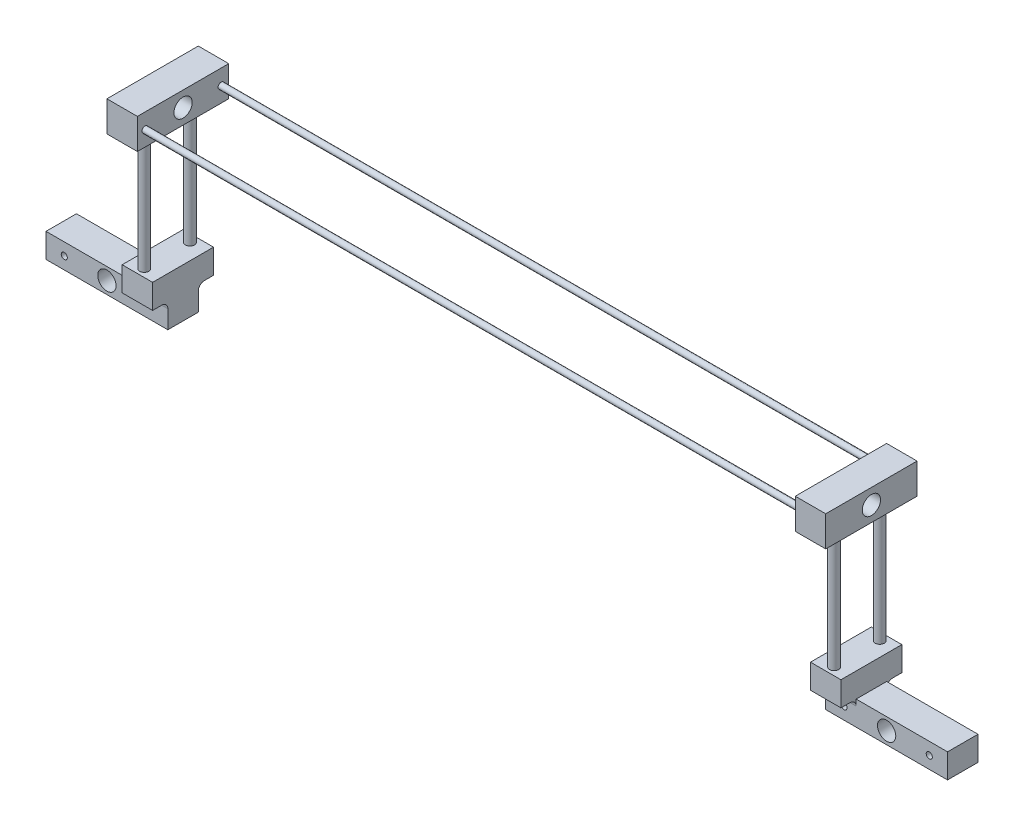
from build123d import *

# Parameters (mm, degrees)
SKETCH1_W                = 200
SKETCH1_H                = 40
SKETCH1_R                = 5
SKETCH1_R_2              = 15
BOSS_EXTRUDE2_DEPTH      = 50
BOSS_EXTRUDE2_2_DEPTH    = 50
SKETCH2_R                = 7.5
BOSS_EXTRUDE4_DEPTH      = 40
BOSS_EXTRUDE5_DEPTH      = 250
BOSS_EXTRUDE5_DEPTH_BACK = 40
SKETCH3_R                = 7.5
SKETCH4_W                = 50
SKETCH4_H                = 100
BOSS_EXTRUDE6_DEPTH      = 50
SKETCH5_R                = 15
CUT_EXTRUDE1_DEPTH       = 1180
SKETCH6_W                = 50
SKETCH6_H                = 25
BOSS_EXTRUDE8_DEPTH      = 50
SKETCH7_R                = 5
BOSS_EXTRUDE9_DEPTH      = 1180
FILLET1_R                = 10


with BuildPart() as part:
    # Sketch1 → Boss-Extrude2 (new body)
    with BuildSketch(Plane.XY):
        with Locations((-640, -58.42888126)):
            Rectangle(SKETCH1_W, SKETCH1_H)
        with Locations((-710, -58.42888126)):
            Circle(SKETCH1_R, mode=Mode.SUBTRACT)
        with Locations((-570, -58.42888126)):
            Circle(SKETCH1_R, mode=Mode.SUBTRACT)
        with Locations((-640, -58.42888126)):
            Circle(SKETCH1_R_2, mode=Mode.SUBTRACT)
    extrude(amount=BOSS_EXTRUDE2_DEPTH)



with BuildPart() as body_2:
    # Sketch1 → Boss-Extrude2 2 (new body)
    with BuildSketch(Plane.XY):
        Polygon((580, -38.42888126), (540, -38.42888126), (540, -78.42888126), (740, -78.42888126), (740, -38.42888126), align=None)
        with Locations((570, -58.42888126)):
            Circle(SKETCH1_R, mode=Mode.SUBTRACT)
        with Locations((640, -58.42888126)):
            Circle(SKETCH1_R_2, mode=Mode.SUBTRACT)
        with Locations((710, -58.42888126)):
            Circle(SKETCH1_R, mode=Mode.SUBTRACT)
    extrude(amount=BOSS_EXTRUDE2_2_DEPTH)


with BuildPart() as part_1:
    add(part.part)

    add(body_2.part)  # Boss-Extrude4 merges body 2
    # Sketch2 → Boss-Extrude4 (add)
    # profile 1 of 2: a face of its own
    with BuildSketch(Plane(origin=(0, -38.42888126, 0), x_dir=(1, 0, 0), z_dir=(0, 1, 0))):
        Polygon((540, -25), (540, -75), (590, -75), (590, -25), (590, 25), (540, 25), align=None)
        with Locations(Location((566.239219394, 12.5, 0), (0, 0, 180))):
            Circle(SKETCH2_R, mode=Mode.SUBTRACT)
        with Locations(Location((566.239219394, -62.5, 0), (0, 0, 180))):
            Circle(SKETCH2_R, mode=Mode.SUBTRACT)
    # profile 2 of 2: a face of its own
    with BuildSketch(Plane(origin=(0, -38.42888126, 0), x_dir=(1, 0, 0), z_dir=(0, 1, 0))):
        Polygon((-590, -25), (-590, 25), (-540, 25), (-540, -25), (-540, -75), (-590, -75), align=None)
        with Locations(Location((-566.239219394, -62.5, 0), (0, 0, 180))):
            Circle(SKETCH2_R, mode=Mode.SUBTRACT)
        with Locations(Location((-566.239219394, 12.5, 0), (0, 0, 180))):
            Circle(SKETCH2_R, mode=Mode.SUBTRACT)
    extrude(amount=BOSS_EXTRUDE4_DEPTH)

    # Sketch3 → Boss-Extrude5 (add, two sides: drawn at the far end of the back side and taken through both)
    with BuildSketch(Plane(origin=(0, 0, 0), x_dir=(1, 0, 0), z_dir=(0, 1, 0)).offset(-BOSS_EXTRUDE5_DEPTH_BACK)):
        with Locations(Location((-566.239219394, 12.5, 0), (0, 0, 270))):
            Circle(SKETCH3_R)
        with Locations(Location((-566.239219394, -62.5, 0), (0, 0, 270))):
            Circle(SKETCH3_R)
        with Locations(Location((566.239219394, 12.5, 0), (0, 0, 270))):
            Circle(SKETCH3_R)
        with Locations(Location((566.239219394, -62.5, 0), (0, 0, 270))):
            Circle(SKETCH3_R)
    extrude(amount=BOSS_EXTRUDE5_DEPTH + BOSS_EXTRUDE5_DEPTH_BACK)

    # Sketch4 → Boss-Extrude6 (add)
    with BuildSketch(Plane(origin=(0, 250, 0), x_dir=(1, 0, 0), z_dir=(0, 1, 0))):
        with Locations((565, -25)):
            Rectangle(SKETCH4_W, SKETCH4_H)
        with Locations((-565, -25)):
            Rectangle(SKETCH4_W, SKETCH4_H)
    extrude(amount=-BOSS_EXTRUDE6_DEPTH)

    # Sketch5 → Cut-Extrude1 (cut)
    with BuildSketch(Plane.ZY.offset(590)):
        with Locations((25, 225)):
            Circle(SKETCH5_R)
    extrude(amount=-CUT_EXTRUDE1_DEPTH, mode=Mode.SUBTRACT)

    # Sketch6 → Boss-Extrude8 (add)
    with BuildSketch(Plane(origin=(0, 250, 0), x_dir=(1, 0, 0), z_dir=(0, 1, 0))):
        with Locations((565, -87.5)):
            Rectangle(SKETCH6_W, SKETCH6_H)
        with Locations((565, 37.5)):
            Rectangle(SKETCH6_W, SKETCH6_H)
        with Locations((-565, -87.5)):
            Rectangle(SKETCH6_W, SKETCH6_H)
        with Locations((-565, 37.5)):
            Rectangle(SKETCH6_W, SKETCH6_H)
    extrude(amount=-BOSS_EXTRUDE8_DEPTH)

    # Sketch7 → Boss-Extrude9 (add)
    with BuildSketch(Plane.ZY.offset(590)):
        with Locations(Location((87.5, 225, 0), (0, 0, 180))):
            Circle(SKETCH7_R)
        with Locations(Location((-37.5, 225, 0), (0, 0, 180))):
            Circle(SKETCH7_R)
    extrude(amount=-BOSS_EXTRUDE9_DEPTH)

    # Fillet1
    # the kernel refuses this fillet: 10 mm, written as the material it adds along each edge
    with BuildSketch(Plane(origin=(540, -38.42888126, 50), x_dir=(0, -1, 0), z_dir=(1, 0, 0)), Plane(origin=(590, -38.42888126, 0), x_dir=(0, -1, 0), z_dir=(-1, 0, 0)), Plane(origin=(-590, -38.42888126, 0), x_dir=(0, 0, -1), z_dir=(1, 0, 0))) as fillet1_piece_1:
        with BuildLine():
            CenterArc((FILLET1_R, -FILLET1_R), FILLET1_R, 90, 90)
            Line((0, -FILLET1_R), (0, 0))
            Line((0, 0), (FILLET1_R, 0))
        make_face()
    extrude(amount=50)
    with BuildSketch(Plane(origin=(-590, -38.42888126, 50), x_dir=(0, 0, 1), z_dir=(1, 0, 0))) as fillet1_piece_2:
        with BuildLine():
            CenterArc((FILLET1_R, FILLET1_R), FILLET1_R, 180, 90)
            Line((0, FILLET1_R), (0, 0))
            Line((0, 0), (FILLET1_R, 0))
        make_face()
    extrude(amount=50)


solid = part_1.part
